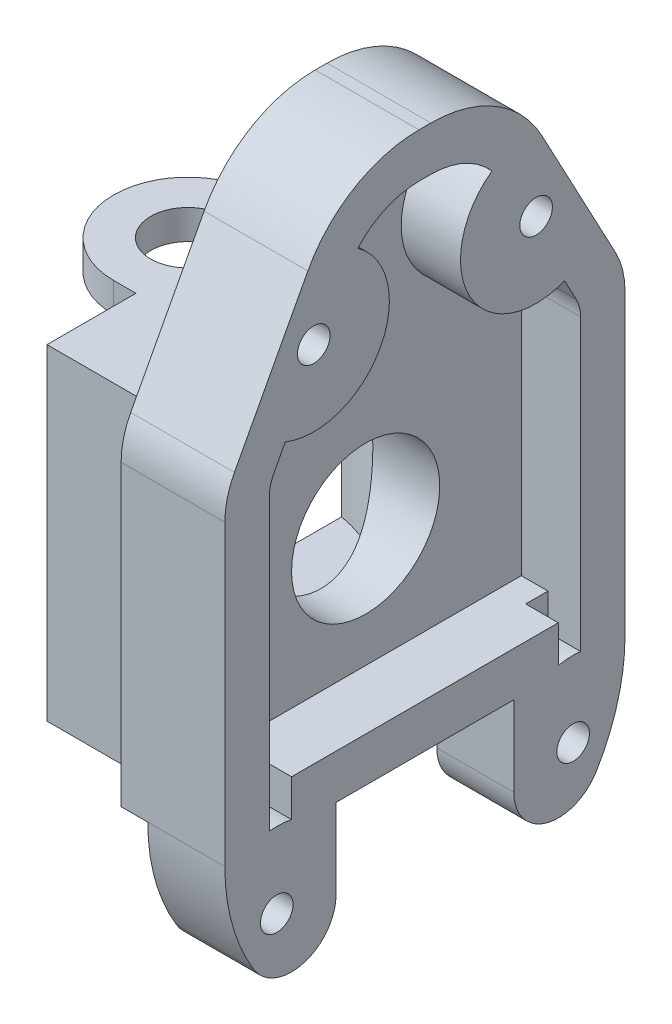
from build123d import *

# Parameters (mm, degrees)
BOSS_EXTRUDE1_DEPTH                  = 7
FILLET1_R                            = 8.5
FILLET2_R                            = 5.5
FILLET3_R                            = 13.5
SKETCH3_W                            = 27
SKETCH3_H                            = 13.5
CUT_EXTRUDE1_DEPTH                   = 1.8
CUT_EXTRUDE5_REACH                   = 37.882
SKETCH12_W                           = 12
SKETCH12_H                           = 13.5
CUT_EXTRUDE6_REACH                   = 37.882
SKETCH13_R                           = 1.1
SKETCH17_R                           = 2.1
CUT_EXTRUDE14_DEPTH                  = 4
FILLET4_R                            = 3
SHELL2_START                         = 3
SHELL2_DEPTH                         = 4
SHELL2_START_2                       = 4.8
SHELL2_2_DEPTH                       = 2.2
SKETCH18_W                           = 22
SKETCH18_H                           = 22
BOSS_EXTRUDE2_DEPTH                  = 9
SKETCH19_W                           = 18
SKETCH19_H                           = 18
CUT_EXTRUDE15_DEPTH                  = 9
SKETCH20_R                           = 5
CUT_EXTRUDE16_DEPTH                  = 3
FILLET5_R                            = 9
SKETCH21_R                           = 5
BOSS_EXTRUDE3_DEPTH                  = 2
CUT_EXTRUDE17_DEPTH                  = 1.5
CUT_EXTRUDE17_DIRECTION_2_REACH      = 40.659
CUT_EXTRUDE17_DIRECTION_2_END_RADIUS = 5
CUT_EXTRUDE18_REACH                  = 43.358
SKETCH23_R                           = 2.5


# Read off the part's stored shape, not the designer's step: Shell2
# Some blends are built 0.0001 mm under size
with BuildPart() as part:
    # Sketch2 → Boss-Extrude1 (new body)
    with BuildSketch(Plane(origin=(0, 0, 0), x_dir=(0, 0, -1), z_dir=(1, 0, 0))):
        Polygon((-13.5, -17.5), (13.5, -17.5), (13.5, 17.5), (5.5, 32.5), (-5.5, 32.5), (-13.5, 17.5), align=None)
    extrude(amount=BOSS_EXTRUDE1_DEPTH)

    # Fillet1
    fillet1_edges = [part.edges().sort_by_distance(p)[0] for p in [
        (3.5, 32.5, 5.5),
        (3.5, 32.5, -5.5),
    ]]
    fillet(fillet1_edges, radius=FILLET1_R)

    # Fillet2
    fillet2_edges = [part.edges().sort_by_distance(p)[0] for p in [
        (3.5, 17.5, -13.5),
        (3.5, 17.5, 13.5),
    ]]
    fillet(fillet2_edges, radius=FILLET2_R)

    # Fillet3
    fillet3_edges = [part.edges().sort_by_distance(p)[0] for p in [
        (3.5, -17.5, 13.5),
        (3.5, -17.5, -13.5),
    ]]
    fillet(fillet3_edges, radius=FILLET3_R - 0.0001)  # a hair under: the kernel refuses the full size

    # Sketch3 → Cut-Extrude1 (cut)
    with BuildSketch(Plane.ZY):
        with Locations((0, -10.75)):
            Rectangle(SKETCH3_W, SKETCH3_H)
    extrude(amount=-CUT_EXTRUDE1_DEPTH, mode=Mode.SUBTRACT)

    # Sketch12 → Cut-Extrude5 (cut, up to next)
    with BuildSketch(Plane(origin=(7, 0, 0), x_dir=(0, 0, -1), z_dir=(1, 0, 0)), mode=Mode.PRIVATE) as cut_extrude5_sk1:
        with Locations((0, -10.75)):
            Rectangle(SKETCH12_W, SKETCH12_H)
    cut_extrude5_tool1 = extrude(cut_extrude5_sk1.sketch, amount=-CUT_EXTRUDE5_REACH, mode=Mode.PRIVATE) & part.part
    add(cut_extrude5_tool1.solids().sort_by_distance((7, -10.75, 0))[0], mode=Mode.SUBTRACT)

    # Sketch13 → Cut-Extrude6 (cut, up to next)
    with BuildSketch(Plane.ZY, mode=Mode.PRIVATE) as cut_extrude6_sk1:
        with Locations((-7.5, 23.5)):
            Circle(SKETCH13_R)
    cut_extrude6_tool1 = extrude(cut_extrude6_sk1.sketch, amount=-CUT_EXTRUDE6_REACH, mode=Mode.PRIVATE) & part.part
    # Sketch13 → Cut-Extrude6 (cut, up to next)
    with BuildSketch(Plane.ZY, mode=Mode.PRIVATE) as cut_extrude6_sk2:
        with Locations((-10, -8.5)):
            Circle(SKETCH13_R)
    cut_extrude6_tool2 = extrude(cut_extrude6_sk2.sketch, amount=-CUT_EXTRUDE6_REACH, mode=Mode.PRIVATE) & part.part
    # Sketch13 → Cut-Extrude6 (cut, up to next)
    with BuildSketch(Plane.ZY, mode=Mode.PRIVATE) as cut_extrude6_sk3:
        with Locations((10, -8.5)):
            Circle(SKETCH13_R)
    cut_extrude6_tool3 = extrude(cut_extrude6_sk3.sketch, amount=-CUT_EXTRUDE6_REACH, mode=Mode.PRIVATE) & part.part
    # Sketch13 → Cut-Extrude6 (cut, up to next)
    with BuildSketch(Plane.ZY, mode=Mode.PRIVATE) as cut_extrude6_sk4:
        with Locations((7.5, 23.5)):
            Circle(SKETCH13_R)
    cut_extrude6_tool4 = extrude(cut_extrude6_sk4.sketch, amount=-CUT_EXTRUDE6_REACH, mode=Mode.PRIVATE) & part.part
    add(cut_extrude6_tool1.solids().sort_by_distance((0, 23.5, -7.5))[0], mode=Mode.SUBTRACT)
    add(cut_extrude6_tool2.solids().sort_by_distance((0, -8.5, -10))[0], mode=Mode.SUBTRACT)
    add(cut_extrude6_tool3.solids().sort_by_distance((0, -8.5, 10))[0], mode=Mode.SUBTRACT)
    add(cut_extrude6_tool4.solids().sort_by_distance((0, 23.5, 7.5))[0], mode=Mode.SUBTRACT)

    # Sketch17 → Cut-Extrude14 (cut)
    with BuildSketch(Plane.ZY):
        with Locations((-7.5, 23.5)):
            Circle(SKETCH17_R)
        with Locations((7.5, 23.5)):
            Circle(SKETCH17_R)
        with Locations((-10, -8.5)):
            Circle(SKETCH17_R)
        with Locations((10, -8.5)):
            Circle(SKETCH17_R)
    extrude(amount=-CUT_EXTRUDE14_DEPTH, mode=Mode.SUBTRACT)

    # Fillet4
    fillet4_edges = [part.edges().sort_by_distance(p)[0] for p in [
        (4.4, -16.093424605, -6),
        (4.4, -16.093424605, 6),
    ]]
    fillet(fillet4_edges, radius=FILLET4_R)

    # Shell2 outline → Shell2 (cut)
    with BuildSketch(Plane.YZ.offset(SHELL2_START)):
        with BuildLine():
            Line((17.301470588, -10.205882353), (18.775176121, -9.419906069))
            ThreePointArc((18.775176121, -9.419906069), (21.033978224, -3.035838645), (27.640649185, -4.522580929))
            ThreePointArc((27.640649185, -4.522580929), (29.013659867, -2.661241858), (29.5, -0.4))
            Line((29.5, -0.4), (29.5, 0.4))
            ThreePointArc((29.5, 0.4), (29.013659867, 2.661241858), (27.640649185, 4.522580929))
            ThreePointArc((27.640649185, 4.522580929), (21.033978224, 3.035838645), (18.775176121, 9.419906069))
            Line((18.775176121, 9.419906069), (17.301470588, 10.205882353))
            ThreePointArc((17.301470588, 10.205882353), (16.731339062, 10.42535625), (16.125, 10.5))
            Line((16.125, 10.5), (-1, 10.5))
            Line((-1, 10.5), (-1, -10.5))
            Line((-1, -10.5), (16.125, -10.5))
            ThreePointArc((16.125, -10.5), (16.731339062, -10.42535625), (17.301470588, -10.205882353))
        make_face()
    extrude(amount=SHELL2_DEPTH, mode=Mode.SUBTRACT)

    # Shell2 2 outline → Shell2 2 (cut)
    with BuildSketch(Plane.YZ.offset(SHELL2_START_2)):
        with BuildLine():
            Line((-3.424568984, -10.5), (-1, -10.5))
            Line((-1, -10.5), (-1, -9))
            Line((-1, -9), (-3.4990001, -9))
            ThreePointArc((-3.4990001, -9), (-3.406267086, -9.747245183), (-3.424568984, -10.5))
        make_face()
        with BuildLine():
            Line((-3.4990001, 9), (-1, 9))
            Line((-1, 9), (-1, 10.5))
            Line((-1, 10.5), (-3.424568984, 10.5))
            ThreePointArc((-3.424568984, 10.5), (-3.406267086, 9.747245183), (-3.4990001, 9))
        make_face()
    extrude(amount=SHELL2_2_DEPTH, mode=Mode.SUBTRACT)

    # Sketch18 → Boss-Extrude2 (add)
    with BuildSketch(Plane.ZY):
        with Locations((0, 7)):
            Rectangle(SKETCH18_W, SKETCH18_H)
    extrude(amount=BOSS_EXTRUDE2_DEPTH)

    # Sketch19 → Cut-Extrude15 (cut)
    with BuildSketch(Plane.ZY.offset(9)):
        with Locations((0, 7)):
            Rectangle(SKETCH19_W, SKETCH19_H)
    extrude(amount=-CUT_EXTRUDE15_DEPTH, mode=Mode.SUBTRACT)

    # Sketch20 → Cut-Extrude16 (cut)
    with BuildSketch(Plane.ZY):
        with Locations((0, 7)):
            Circle(SKETCH20_R)
    extrude(amount=-CUT_EXTRUDE16_DEPTH, mode=Mode.SUBTRACT)

    # Fillet5
    # the kernel refuses this fillet: 9 mm, written as the material it adds along each edge
    with BuildSketch(Plane(origin=(0, 16, -9), x_dir=(-1, 0, 0), z_dir=(0, -1, 0))) as fillet5_piece_1_section:
        with BuildLine():
            CenterArc((FILLET5_R, -FILLET5_R), FILLET5_R, 90, 90)
            Line((0, -FILLET5_R), (0, 0))
            Line((0, 0), (FILLET5_R, 0))
        make_face()
    fillet5_piece_1 = extrude(amount=18, mode=Mode.PRIVATE)
    fillet5_piece_1 = fillet5_piece_1 - Plane(origin=(-0.132604543, 7, 0), x_dir=(0, 0, 1), z_dir=(-1, 0, 0)) * Cylinder(5, 72, mode=Mode.PRIVATE)
    add(fillet5_piece_1)
    with BuildSketch(Plane(origin=(0, -2, 9), x_dir=(-1, 0, 0), z_dir=(0, 1, 0))) as fillet5_piece_2_section:
        with BuildLine():
            CenterArc((FILLET5_R, -FILLET5_R), FILLET5_R, 90, 90)
            Line((0, -FILLET5_R), (0, 0))
            Line((0, 0), (FILLET5_R, 0))
        make_face()
    fillet5_piece_2 = extrude(amount=18, mode=Mode.PRIVATE)
    fillet5_piece_2 = fillet5_piece_2 - Plane(origin=(-2.089358555, 7, 0), x_dir=(0, 0, 1), z_dir=(-1, 0, 0)) * Cylinder(5, 72, mode=Mode.PRIVATE)
    add(fillet5_piece_2)

    # Sketch21 → Boss-Extrude3 (add)
    with BuildSketch(Plane(origin=(0, 18, 0), x_dir=(1, 0, 0), z_dir=(0, 1, 0))):
        with Locations((-9, 0)):
            Circle(SKETCH21_R)
    boss_extrude3 = extrude(amount=-BOSS_EXTRUDE3_DEPTH)

    # Mirror1: Boss-Extrude3 across plane
    add(boss_extrude3.mirror(Plane.ZX.offset(7)))

    # Sketch22 → Cut-Extrude17 (cut)
    with BuildSketch(Plane.ZY.offset(9)):
        Polygon((-5, 16), (-5, 18), (-11, 18), (-11, -4), (-5, -4), (-5, -2), (5, -2), (5, -4), (11, -4), (11, 18), (5, 18), (5, 16), align=None)
    extrude(amount=-CUT_EXTRUDE17_DEPTH, mode=Mode.SUBTRACT)

    # Cut-Extrude17 direction 2: up to this cylinder (the profile starts inside it)
    cut_extrude17_direction_2_end = Plane(origin=(-9, 7, 0), z_dir=(0, 1, 0)) * Cylinder(CUT_EXTRUDE17_DIRECTION_2_END_RADIUS, 92.318, mode=Mode.PRIVATE)
    # Sketch22 → Cut-Extrude17 direction 2 (cut, up to the surface)
    with BuildSketch(Plane.ZY.offset(9), mode=Mode.PRIVATE) as cut_extrude17_direction_2_sk1:
        Polygon((-5, 16), (-5, 18), (-11, 18), (-11, -4), (-5, -4), (-5, -2), (5, -2), (5, -4), (11, -4), (11, 18), (5, 18), (5, 16), align=None)
    cut_extrude17_direction_2_tool1 = extrude(cut_extrude17_direction_2_sk1.sketch, amount=CUT_EXTRUDE17_DIRECTION_2_REACH, mode=Mode.PRIVATE) & cut_extrude17_direction_2_end
    add(cut_extrude17_direction_2_tool1.solids().sort_by_distance((-9, 7, 0))[0], mode=Mode.SUBTRACT)

    # Cut-Extrude18: up to this face of the body (flat: up to its plane)
    cut_extrude18_end = Plane(part.part.faces().sort_by_distance((-5.378131987, 18, 0))[0])
    # Sketch23 → Cut-Extrude18 (cut, up to the picked face)
    with BuildSketch(Plane.XZ.offset(4), mode=Mode.PRIVATE) as cut_extrude18_sk1:
        with Locations(Location((-9, 0, 0), (0, 0, 270))):
            Circle(SKETCH23_R)
    cut_extrude18_tool1 = split(extrude(cut_extrude18_sk1.sketch, amount=-CUT_EXTRUDE18_REACH, mode=Mode.PRIVATE), bisect_by=cut_extrude18_end, keep=Keep.BOTH, mode=Mode.PRIVATE)
    add(cut_extrude18_tool1.solids().sort_by(Axis((-9, -4, 0), (0, 1, 0)))[0], mode=Mode.SUBTRACT)


solid = part.part
